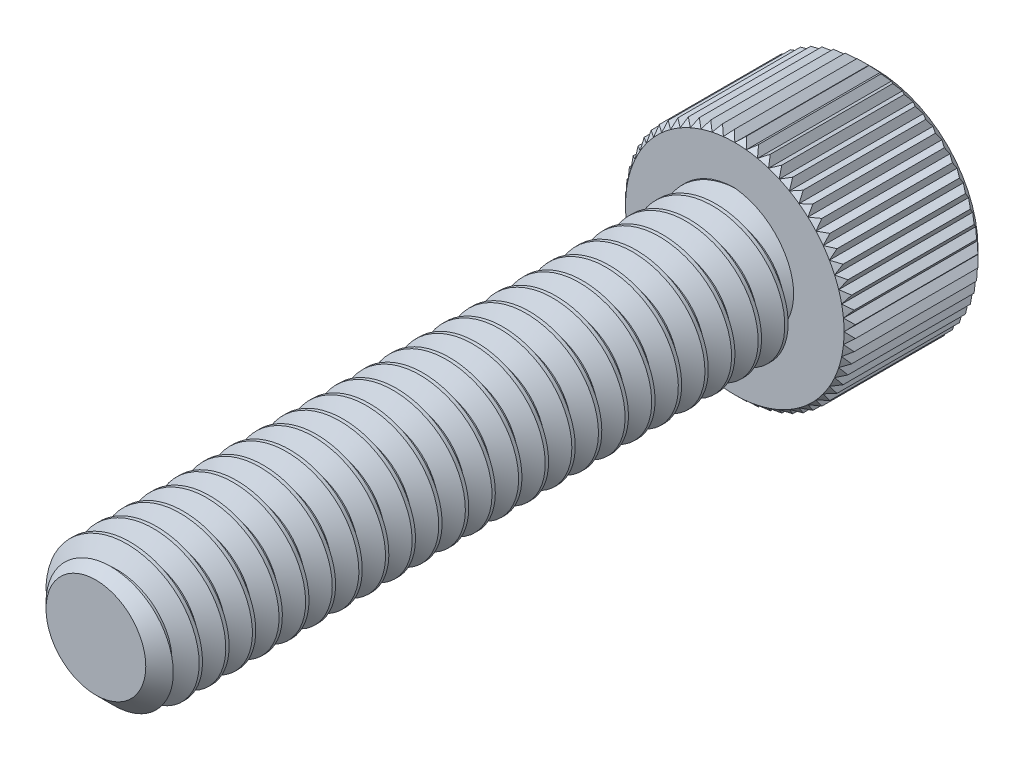
from build123d import *
from build123d.topology import SkipClean

# Parameters (mm, degrees)
SKETCH1_R          = 2.0828
EXTRUDE1_DEPTH     = 19.05
CHAMFER3_SIZE      = 0.5953125
CUT_SWEEP1_PITCH   = 0.79375
SKETCH6_R          = 3.429
EXTRUDE2_DEPTH     = 4.1656
CUT_EXTRUDE1_DEPTH = 2.67890625
CHAMFER1_SIZE      = 0.3429
CHAMFER2_SIZE      = 0.17145
CUT_EXTRUDE3_DEPTH = 20.657532546
CIRPATTERN1_COUNT  = 60


with BuildPart() as part:
    # Sketch1 → Extrude1 (new body)
    with BuildSketch(Plane.XY):
        Circle(SKETCH1_R)
    extrude(amount=-EXTRUDE1_DEPTH)

    # Chamfer3
    chamfer3_edges = [part.edges().sort_by_distance(p)[0] for p in [
        (-2.0828, 0, 0),
    ]]
    chamfer(chamfer3_edges, length=CHAMFER3_SIZE)

    # Cut-Sweep1: arcs per turn and ends read off the stored shape
    # Cut-Sweep1: the profile of Sketch3 profile screwed along a right-hand helix through 26 turns, 6 arcs to a turn; built about Z, then put on its axis
    cut_sweep1_z = Axis((0, 0, 0), (0, 0, 1))
    cut_sweep1_corners = [(2.0831, 0, -0.694704455), (1.567244252, 0, -0.396875), (1.567244252, 0, -0.29765625), (2.0831, 0, 0.000173205)]
    with BuildLine(mode=Mode.PRIVATE) as cut_sweep1_profile:
        Line(cut_sweep1_corners[0], cut_sweep1_corners[1])
        Line(cut_sweep1_corners[1], cut_sweep1_corners[2])
        Line(cut_sweep1_corners[2], cut_sweep1_corners[3])
        Line(cut_sweep1_corners[3], cut_sweep1_corners[0])
    cut_sweep1_cap = Face(cut_sweep1_profile.wire())
    cut_sweep1_turn_angles = [0, 30, 60, 90, 120, 150, 180, 210, 240, 270, 300, 330, 360]
    cut_sweep1_turn_weights = [1, 0.8660254037844387, 1, 0.8660254037844387, 1, 0.8660254037844387, 1, 0.8660254037844387, 1, 0.8660254037844387, 1, 0.8660254037844387, 1]
    cut_sweep1_turn_rails = [Edge.make_bspline([Vector(p[0], p[1], 0).rotate(cut_sweep1_z, cut_sweep1_turn_angles[k]) / cut_sweep1_turn_weights[k] + Vector(0, 0, p[2] + CUT_SWEEP1_PITCH * cut_sweep1_turn_angles[k] / 360) for k in range(13)], [0, 0, 0, 1, 1, 2, 2, 3, 3, 4, 4, 5, 5, 6, 6, 6], 2, cut_sweep1_turn_weights) for p in cut_sweep1_corners]
    cut_sweep1_turn_sides = [Face.make_surface_from_curves(cut_sweep1_turn_rails[p[0]], cut_sweep1_turn_rails[p[1]]) for p in [(0, 1), (1, 2), (2, 3), (3, 0)]]
    cut_sweep1 = Plane(origin=(0, 0, 0), x_dir=(0, 1, 0), z_dir=(0, 0, -1)) * Solid(Shell([*[p.moved(Location((0, 0, CUT_SWEEP1_PITCH * i))) for i in range(26) for p in cut_sweep1_turn_sides], cut_sweep1_cap, cut_sweep1_cap.rotate(cut_sweep1_z, 9360).moved(Location((0, 0, CUT_SWEEP1_PITCH * 9360 / 360)))]))
    add(cut_sweep1, mode=Mode.SUBTRACT)

    # Sketch6 → Extrude2 (add)
    with BuildSketch(Plane(origin=(0, 0, -19.05), x_dir=(-1, 0, 0), z_dir=(0, 0, -1))):
        Circle(SKETCH6_R)
    extrude(amount=EXTRUDE2_DEPTH)

    # Sketch7 → Cut-Extrude1 (cut)
    with BuildSketch(Plane(origin=(0, 0, -23.2156), x_dir=(-1, 0, 0), z_dir=(0, 0, -1))):
        Polygon((0, 2.062222993), (-1.7859375, 1.031111496), (-1.7859375, -1.031111496), (0, -2.062222993), (1.7859375, -1.031111496), (1.7859375, 1.031111496), align=None)
    extrude(amount=-CUT_EXTRUDE1_DEPTH, mode=Mode.SUBTRACT)

    # Cut-Extrude2 cone 1 section (through the dimple's axis) → Cut-Extrude2 (revolve, cut)
    with BuildSketch(Plane(origin=(0, 0, -23.2156), x_dir=(0, 1, 0), z_dir=(1, 0, 0))):
        Polygon((0, 0), (2.062222993, 0), (0, 2.062222993), align=None)
    revolve(axis=Axis((0, 0, -23.2156), (0, 0, 1)), mode=Mode.SUBTRACT)

    # Chamfer1
    chamfer1_edges = [part.edges().sort_by_distance(p)[0] for p in [
        (3.429, 0, -23.2156),
    ]]
    chamfer(chamfer1_edges, length=CHAMFER1_SIZE)

    # Chamfer2
    chamfer2_edges = [part.edges().sort_by_distance(p)[0] for p in [
        (3.429, 0, -19.05),
    ]]
    chamfer(chamfer2_edges, length=CHAMFER2_SIZE)

    # Sketch10 → Cut-Extrude3 (cut, through all)
    with SkipClean():  # the faces are left unmerged after this step: merging them gives an invalid solid
        with BuildSketch(Plane.XY.offset(-19.05)):
            Polygon((-0.36903498, 3.60045), (0, 3.25755), (0.36903498, 3.60045), align=None)
        cut_extrude3 = extrude(amount=-CUT_EXTRUDE3_DEPTH, mode=Mode.SUBTRACT)

    # CirPattern1: Cut-Extrude3 ×60 about axis
    cirpattern1_axis = Axis((0, 0, 0), (0, 0, 1))
    for i in range(1, CIRPATTERN1_COUNT):
        add(cut_extrude3.rotate(cirpattern1_axis, i * 360 / CIRPATTERN1_COUNT), mode=Mode.SUBTRACT)


solid = part.part
